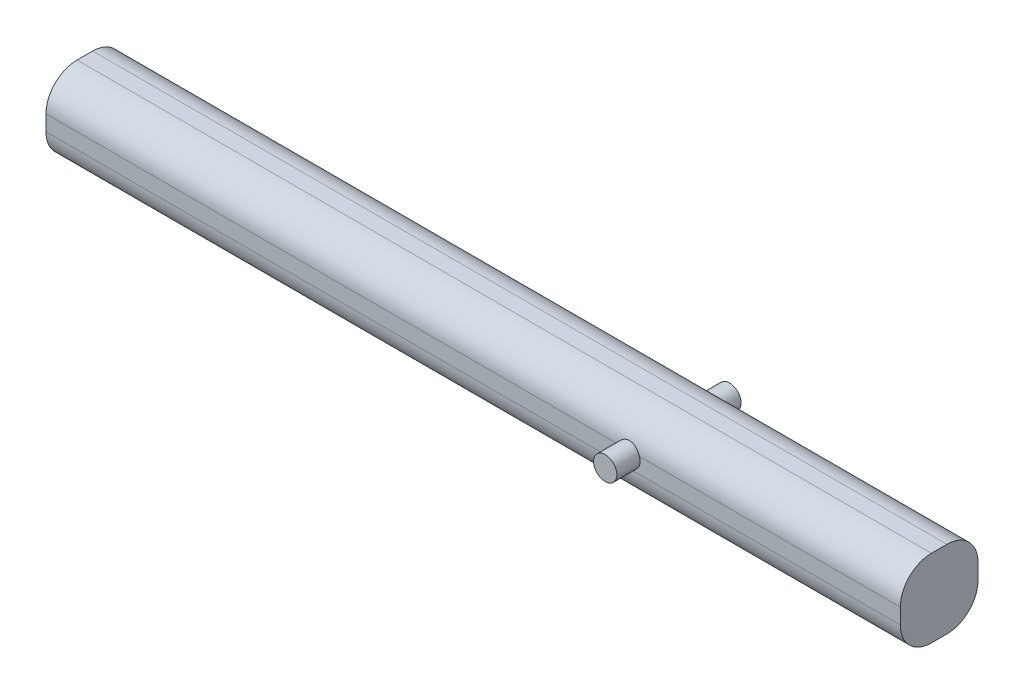
from build123d import *

# Parameters (mm, degrees)
SKETCH1_W                = 5500
SKETCH1_H                = 500
BOSS_EXTRUDE1_DEPTH      = 500
FILLET1_R                = 200
SKETCH2_R                = 210
CUT_EXTRUDE1_DEPTH       = 5499
BOSS_EXTRUDE2_DEPTH      = 150
BOSS_EXTRUDE2_DEPTH_BACK = 650
SKETCH3_R                = 75
SKETCH4_R                = 210
CUT_EXTRUDE2_DEPTH       = 5499


with BuildPart() as part:
    # Sketch1 → Boss-Extrude1 (new body)
    with BuildSketch(Plane.XY):
        with Locations((429.96742671, 936.889250814)):
            Rectangle(SKETCH1_W, SKETCH1_H)
    extrude(amount=BOSS_EXTRUDE1_DEPTH)

    # Fillet1
    fillet1_edges = [part.edges().sort_by_distance(p)[0] for p in [
        (429.96742671, 686.889250814, 0),
        (429.96742671, 686.889250814, 500),
        (429.96742671, 1186.889250814, 0),
        (429.96742671, 1186.889250814, 500),
    ]]
    fillet(fillet1_edges, radius=FILLET1_R)

    # Sketch2 → Cut-Extrude1 (cut)
    with BuildSketch(Plane.ZY.offset(2320.03257329)):
        with Locations((255, 941.889250814)):
            Circle(SKETCH2_R)
    extrude(amount=-CUT_EXTRUDE1_DEPTH, mode=Mode.SUBTRACT)

    # Sketch3 → Boss-Extrude2 (add, two sides: drawn at the far end of the back side and taken through both)
    with BuildSketch(Plane.XY.offset(500).offset(-BOSS_EXTRUDE2_DEPTH_BACK)):
        with Locations((1429.96742671, 961.889250814)):
            Circle(SKETCH3_R)
    extrude(amount=BOSS_EXTRUDE2_DEPTH + BOSS_EXTRUDE2_DEPTH_BACK)

    # Sketch4 → Cut-Extrude2 (cut)
    with BuildSketch(Plane.ZY.offset(2320.03257329)):
        with Locations((255, 941.889250814)):
            Circle(SKETCH4_R)
    extrude(amount=-CUT_EXTRUDE2_DEPTH, mode=Mode.SUBTRACT)


solid = part.part
